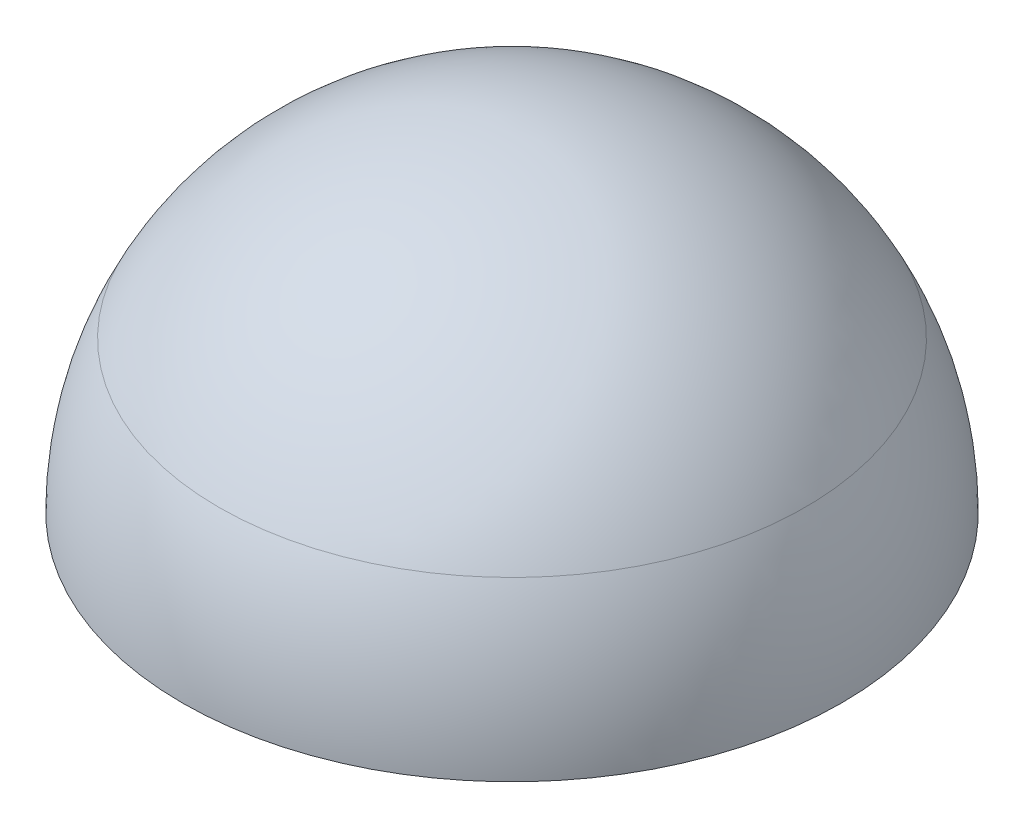
from build123d import *

# Parameters (mm, degrees)
REVOLVE_1_ANGLE = 180
SKETCH_8_W      = 8
SKETCH_8_H      = 4.123105626
SKETCH_7_W      = 8
SKETCH_7_H      = 4.896318498


with BuildPart() as part:
    # 草图1 → 旋转1 (revolve)
    with BuildSketch(Plane(origin=(0, 0, 0), x_dir=(1, 0, 0), z_dir=(0, 1, 0))):
        with BuildLine():
            Line((0, 9), (0, -9))
            ThreePointArc((0, -9), (9, 0), (0, 9))
        make_face()
    revolve(axis=Axis((0, 0, -9), (0, 0, 1)), revolution_arc=REVOLVE_1_ANGLE)

    # 草图8 → 切除-旋转4 (revolve, cut)
    with BuildSketch(Plane(origin=(0, 0, 0), x_dir=(0, 0, -1), z_dir=(1, 0, 0))):
        with Locations((4, 2.061552813)):
            Rectangle(SKETCH_8_W, SKETCH_8_H)
    revolve(axis=Axis((0, 0, 0), (0, 1, 0)), mode=Mode.SUBTRACT)

    # 草图7 → 切除-旋转2 (revolve, cut)
    with BuildSketch(Plane(origin=(0, 0, 0), x_dir=(0, 0, -1), z_dir=(1, 0, 0))):
        with Locations((4, -2.551840751)):
            Rectangle(SKETCH_7_W, SKETCH_7_H)
    revolve(axis=Axis((0, -0.103681502, 0), (0, -1, 0)), mode=Mode.SUBTRACT)


solid = part.part
